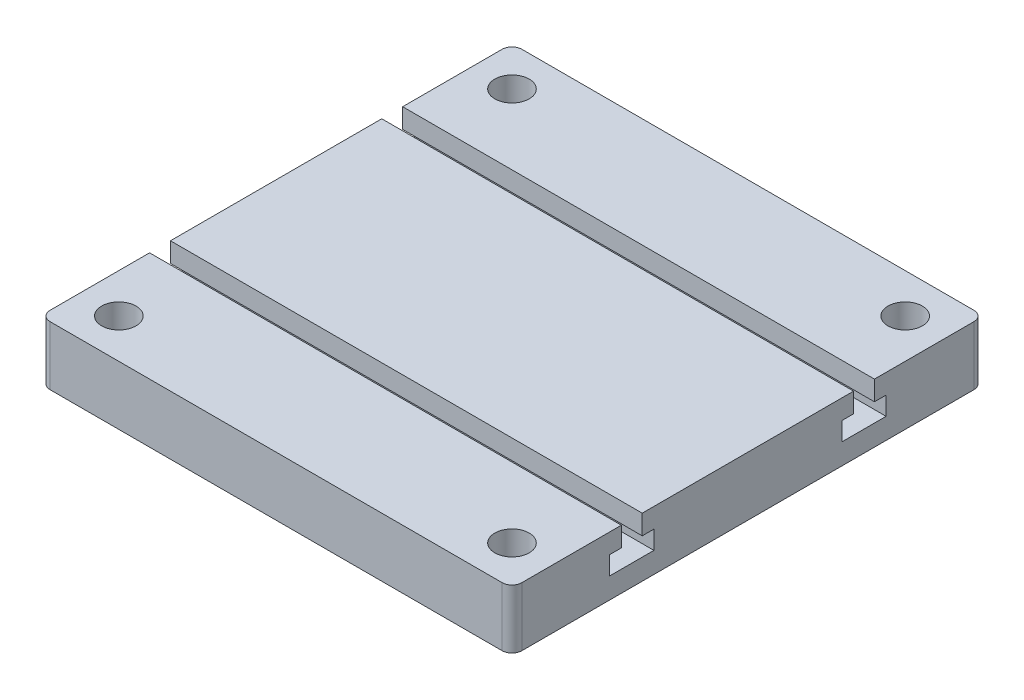
from build123d import *

# Parameters (mm, degrees)
SKETCH1_W                                        = 152.4
SKETCH1_H                                        = 152.4
BOSS_EXTRUDE1_DEPTH                              = 19.05
CBORE_FOR_1_4_SOCKET_HEAD_CAP_SCREW1_D           = 6.5278
CBORE_FOR_1_4_SOCKET_HEAD_CAP_SCREW1_CBORE_D     = 11.1125
CBORE_FOR_1_4_SOCKET_HEAD_CAP_SCREW1_CBORE_DEPTH = 8.89
T_SLOT_CUT_WITH_MCMASTER_8789A16_BIT_DEPTH       = 172.45
FILLET1_R                                        = 3.175


with BuildPart() as part:
    # Sketch1 → Boss-Extrude1 (new body)
    with BuildSketch(Plane(origin=(0, 0, 0), x_dir=(1, 0, 0), z_dir=(0, 1, 0))):
        Rectangle(SKETCH1_W, SKETCH1_H)
    extrude(amount=BOSS_EXTRUDE1_DEPTH)

    # CBORE for 1/4 Socket Head Cap Screw1 (through all)
    with Locations(Plane(origin=(0, 19.05, 0), x_dir=(1, 0, 0), z_dir=(0, 1, 0))):
        with Locations((-63.5, 63.5), (63.5, 63.5), (63.5, -63.5), (-63.5, -63.5)):
            CounterBoreHole(CBORE_FOR_1_4_SOCKET_HEAD_CAP_SCREW1_D / 2, CBORE_FOR_1_4_SOCKET_HEAD_CAP_SCREW1_CBORE_D / 2, CBORE_FOR_1_4_SOCKET_HEAD_CAP_SCREW1_CBORE_DEPTH)

    # Sketch4 → T-SLOT CUT WITH MCMASTER 8789A16 BIT (cut, through all)
    with BuildSketch(Plane(origin=(-76.2, 0, 0), x_dir=(0, 0, -1), z_dir=(1, 0, 0))):
        Polygon((-40.8765375, 19.05), (-40.8765375, 12.7), (-44.64685, 12.7), (-44.64685, 6.746875), (-30.35935, 6.746875), (-30.35935, 12.7), (-34.1296625, 12.7), (-34.1296625, 19.05), align=None)
        Polygon((34.1296625, 12.7), (34.1296625, 19.05), (40.8765375, 19.05), (40.8765375, 12.7), (44.64685, 12.7), (44.64685, 6.746875), (30.35935, 6.746875), (30.35935, 12.7), align=None)
    extrude(amount=T_SLOT_CUT_WITH_MCMASTER_8789A16_BIT_DEPTH, mode=Mode.SUBTRACT)

    # Fillet1
    fillet1_edges = [part.edges().sort_by_distance(p)[0] for p in [
        (-76.2, 9.525, 76.2),
        (76.2, 9.525, 76.2),
        (76.2, 9.525, -76.2),
        (-76.2, 9.525, -76.2),
    ]]
    fillet(fillet1_edges, radius=FILLET1_R)


solid = part.part
